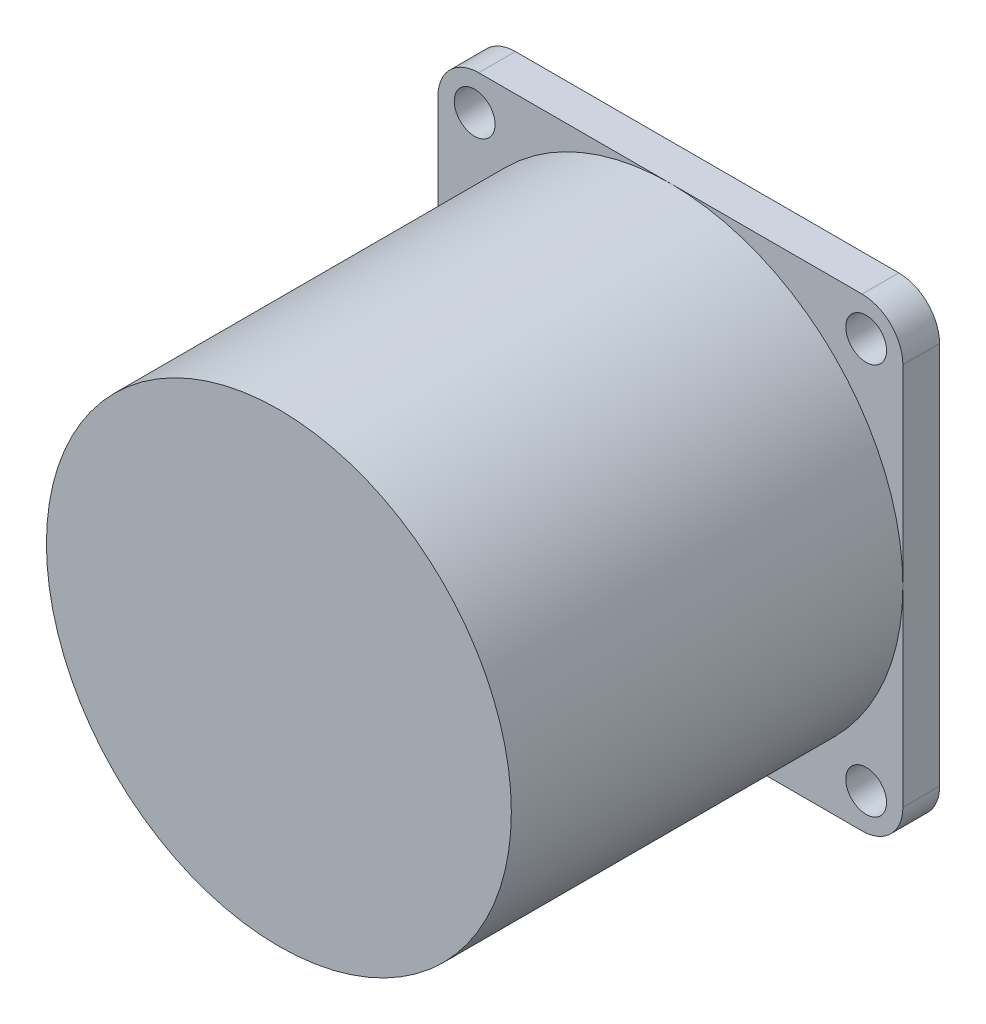
from build123d import *

# Parameters (mm, degrees)
ESQUISSE1_W        = 57
ESQUISSE1_H        = 57
ESQUISSE1_R        = 2.5
BOSS_EXTRU_1_DEPTH = 4.5
CONG_2_R           = 5
ESQUISSE2_R        = 19
BOSS_EXTRU_2_DEPTH = 1
CHANFREIN1_SIZE    = 1
ESQUISSE3_R        = 28.5
BOSS_EXTRU_3_DEPTH = 48
ESQUISSE4_R        = 6.75
BOSS_EXTRU_4_DEPTH = 1.5
ESQUISSE5_R        = 3
BOSS_EXTRU_5_DEPTH = 20


with BuildPart() as part:
    # Esquisse1 → Boss.-Extru.1 (new body)
    with BuildSketch(Plane.XY):
        with Locations((-1.798558634, -6.791590494)):
            Rectangle(ESQUISSE1_W, ESQUISSE1_H)
        with Locations((-25.798558634, 17.208409506)):
            Circle(ESQUISSE1_R, mode=Mode.SUBTRACT)
        with Locations((22.201441366, 17.208409506)):
            Circle(ESQUISSE1_R, mode=Mode.SUBTRACT)
        with Locations((22.201441366, -30.791590494)):
            Circle(ESQUISSE1_R, mode=Mode.SUBTRACT)
        with Locations((-25.798558634, -30.791590494)):
            Circle(ESQUISSE1_R, mode=Mode.SUBTRACT)
    extrude(amount=BOSS_EXTRU_1_DEPTH)

    # Congé2
    cong_2_edges = [part.edges().sort_by_distance(p)[0] for p in [
        (-30.298558634, 21.708409506, 2.25),
        (26.701441366, 21.708409506, 2.25),
        (26.701441366, -35.291590494, 2.25),
        (-30.298558634, -35.291590494, 2.25),
    ]]
    fillet(cong_2_edges, radius=CONG_2_R)

    # Esquisse2 → Boss.-Extru.2 (add)
    with BuildSketch(Plane(origin=(0, 0, 0), x_dir=(-1, 0, 0), z_dir=(0, 0, -1))):
        with Locations(Location((1.798558634, -6.791590494, 0), (0, 0, 180))):
            Circle(ESQUISSE2_R)
    extrude(amount=BOSS_EXTRU_2_DEPTH)

    # Chanfrein1
    chanfrein1_edges = [part.edges().sort_by_distance(p)[0] for p in [
        (-20.798558634, -6.791590494, -1),
    ]]
    chamfer(chanfrein1_edges, length=CHANFREIN1_SIZE - 0.0001)  # a hair under: the kernel refuses the full size

    # Esquisse3 → Boss.-Extru.3 (add)
    with BuildSketch(Plane.XY.offset(4.5)):
        with Locations((-1.798558634, -6.791590494)):
            Circle(ESQUISSE3_R)
    extrude(amount=BOSS_EXTRU_3_DEPTH)

    # Esquisse4 → Boss.-Extru.4 (add)
    with BuildSketch(Plane(origin=(0, 0, -1), x_dir=(-1, 0, 0), z_dir=(0, 0, -1))):
        with Locations((1.798558634, -6.791590494)):
            Circle(ESQUISSE4_R)
    extrude(amount=BOSS_EXTRU_4_DEPTH)

    # Esquisse5 → Boss.-Extru.5 (add)
    with BuildSketch(Plane(origin=(0, 0, -2.5), x_dir=(-1, 0, 0), z_dir=(0, 0, -1))):
        with Locations((1.798558634, -6.791590494)):
            Circle(ESQUISSE5_R)
    extrude(amount=BOSS_EXTRU_5_DEPTH)


solid = part.part
